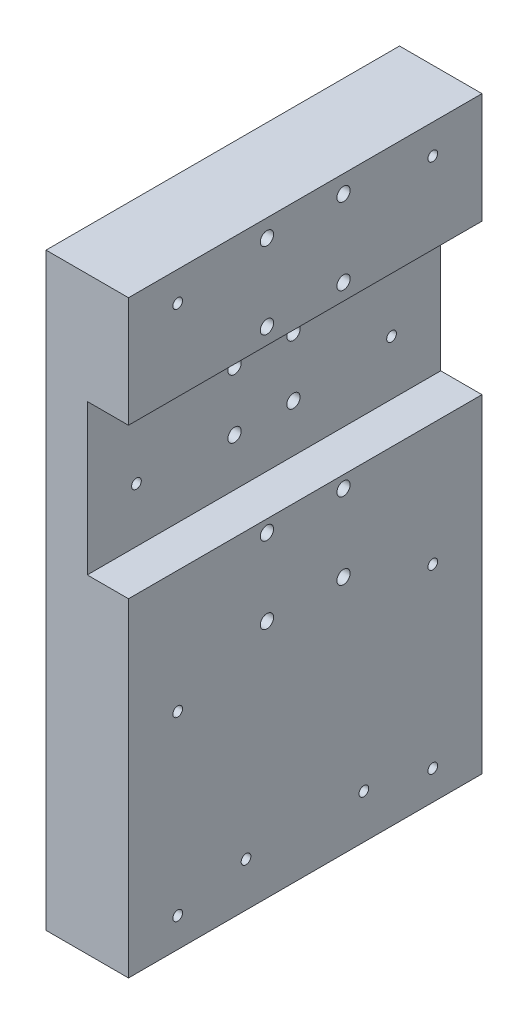
from build123d import *

# Parameters (mm, degrees)
BOSS_EXTRUDE1_DEPTH            = 120
CBORE_FOR_M4_SHCS4_D           = 4.5
CBORE_FOR_M4_SHCS4_CBORE_D     = 8
CBORE_FOR_M4_SHCS4_CBORE_DEPTH = 4
M4_TAPPED_HOLE1_D              = 3.3
M5_TAPPED_HOLE1_D              = 4.2
M5_TAPPED_HOLE1_DEPTH          = 17.4
M5_TAPPED_HOLE1_TIP            = 1.2618073
M4_TAPPED_HOLE2_D              = 3.3


with BuildPart() as part:
    # Sketch1 → Boss-Extrude1 (new body)
    with BuildSketch(Plane.XY):
        Polygon((0, 0), (0, 200), (28, 200), (28, 162.5), (14, 162.5), (14, 111.5), (28, 111.5), (28, 0), align=None)
    extrude(amount=BOSS_EXTRUDE1_DEPTH)

    # CBORE for M4 SHCS4 (through all)
    with Locations(Plane(origin=(0, 194, 73), x_dir=(0, 0, -1), z_dir=(-1, 0, 0))):
        with Locations((0, 0), (0, 26), (3, 46.3), (3, 66.3), (0, 86.6), (0, 112.6), (26, 112.6), (26, 86.6), (23, 66.3), (23, 46.3), (26, 26), (26, 0)):
            CounterBoreHole(CBORE_FOR_M4_SHCS4_D / 2, CBORE_FOR_M4_SHCS4_CBORE_D / 2, CBORE_FOR_M4_SHCS4_CBORE_DEPTH)

    # M4 Tapped Hole1 (through all)
    with Locations(Plane(origin=(0, 190, 16.7), x_dir=(0, 0, -1), z_dir=(-1, 0, 0))):
        with Locations((0, 0), (0, 60), (0, 120), (0, 180), (-86.6, 180), (-86.6, 120), (-86.6, 60), (-86.6, 0)):
            Hole(M4_TAPPED_HOLE1_D / 2)

    # M5 Tapped Hole1
    with Locations(Plane(origin=(14, 0, 90), x_dir=(-1, 0, 0), z_dir=(0, -1, 0))):
        with Locations((0, 0), (0, 30), (0, 60)):
            Hole(M5_TAPPED_HOLE1_D / 2, depth=M5_TAPPED_HOLE1_DEPTH)
            with Locations((0, 0, -(M5_TAPPED_HOLE1_DEPTH + M5_TAPPED_HOLE1_TIP / 2))):  # 118° drill point
                Cone(0, M5_TAPPED_HOLE1_D / 2, M5_TAPPED_HOLE1_TIP, mode=Mode.SUBTRACT)

    # M4 Tapped Hole2 (through all)
    with Locations(Plane(origin=(28, 15, 80.1), x_dir=(0, 1, 0), z_dir=(1, 0, 0))):
        with Locations((0, 0), (0, -40)):
            Hole(M4_TAPPED_HOLE2_D / 2)


solid = part.part
